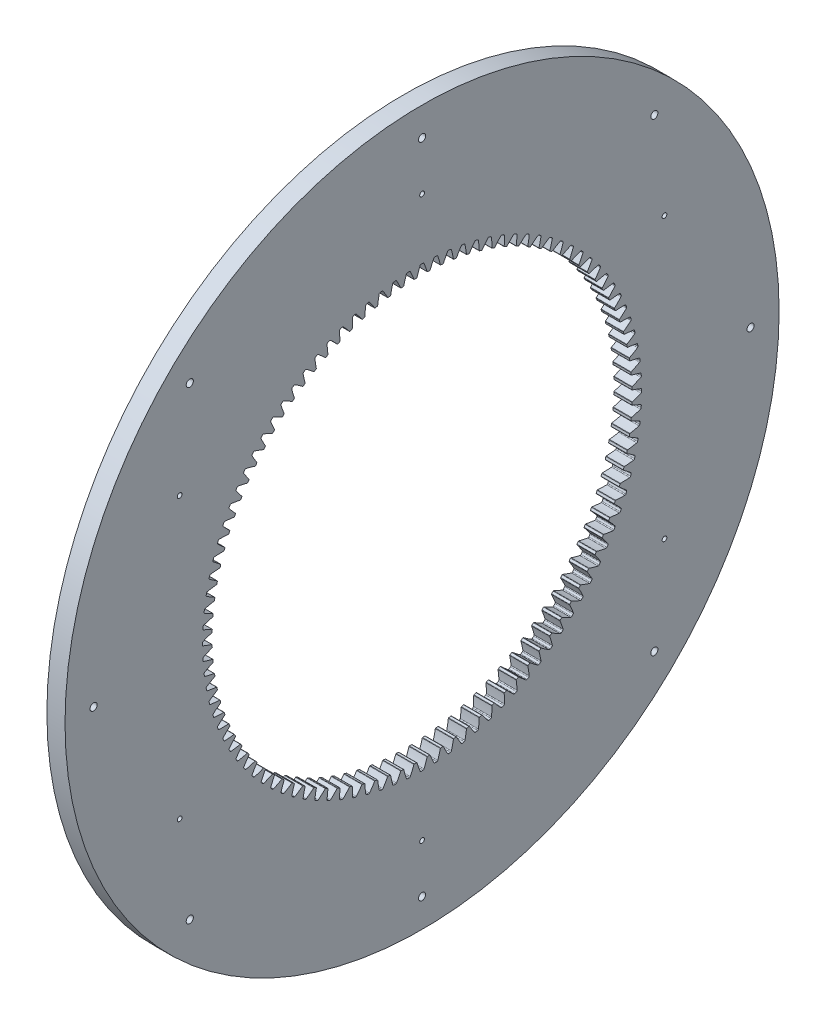
from build123d import *

# Parameters (mm, degrees)
BASPROSKE_W                 = 12.7
BASPROSKE_H                 = 103
TOOTHCUT_DEPTH              = 354.781415566
BREAKS_R                    = 0.3
ROOTFILLETS_R               = 0.751
TEETHCUTS_COUNT             = 100
TEETHCUTS_ANGLE             = 356.4
BREAKS_OF_TEETHCUTS_R       = 0.3
ROOTFILLETS_OF_TEETHCUTS_R  = 0.751
TAP_DRILL_FOR_M6X1_0_TAP1_D = 5
TAP_DRILL_FOR_M4X0_7_TAP1_D = 3.3


with BuildPart() as part:
    # BasProSke → Base-Revolve (revolve)
    with BuildSketch(Plane(origin=(0, 0, 0), x_dir=(1, 0, 0), z_dir=(0, 1, 0)), mode=Mode.PRIVATE) as base_revolve_sk:
        with Locations((6.35, 198.5)):
            Rectangle(BASPROSKE_W, BASPROSKE_H)
    revolve(base_revolve_sk.sketch.rotate(Axis((-10, 0, 0), (1, 0, 0)), 180), axis=Axis((-10, 0, 0), (1, 0, 0)))

    # TooCutSke → ToothCut (cut, through all)
    with BuildSketch(Plane(origin=(0, 0, 0), x_dir=(0, 0, -1), z_dir=(1, 0, 0))):
        with BuildLine():
            ThreePointArc((3.637427826, 146.929582331), (2.482947495, 150.368007742), (1.163580625, 153.746596974))
            ThreePointArc((1.163580625, 153.746596974), (0, 153.751), (-1.163580625, 153.746596974))
            ThreePointArc((-1.163580625, 153.746596974), (-2.482947495, 150.368007742), (-3.637427826, 146.929582331))
            ThreePointArc((-3.637427826, 146.929582331), (0, 146.9746), (3.637427826, 146.929582331))
        make_face()
    toothcut = extrude(amount=TOOTHCUT_DEPTH, mode=Mode.SUBTRACT)

    # Breaks
    breaks_edges = [part.edges().sort_by_distance(p)[0] for p in [
        (6.35, 146.955185887, 3.629509754),
        (6.35, 146.955185887, -3.629509754),
    ]]
    fillet(breaks_edges, radius=BREAKS_R)

    # RootFillets
    rootfillets_edges = [part.edges().sort_by_distance(p)[0] for p in [
        (6.35, 153.746596974, 1.163580625),
        (6.35, 153.746596974, -1.163580625),
    ]]
    fillet(rootfillets_edges, radius=ROOTFILLETS_R)

    # TeethCuts: ToothCut ×100 about axis
    teethcuts_axis = Axis((-10, 0, 0), (1, 0, 0))
    for i in range(1, TEETHCUTS_COUNT):
        add(toothcut.rotate(teethcuts_axis, i * TEETHCUTS_ANGLE / (TEETHCUTS_COUNT - 1)), mode=Mode.SUBTRACT)

    # Breaks of TeethCuts
    breaks_of_teethcuts_edges = [part.edges().sort_by_distance(p)[0] for p in [
        (6.35, 146.437304593, 12.849740215),
        (6.35, 146.893102199, 5.605044724),
        (6.35, 145.341502159, 22.019258622),
        (6.35, 146.251298546, 14.817478651),
        (6.35, 143.672103216, 31.101877075),
        (6.35, 145.032307834, 23.971434759),
        (6.35, 141.435696119, 40.061750627),
        (6.35, 143.240940861, 33.030786565),
        (6.35, 138.641106945, 48.863518753),
        (6.35, 140.884267336, 41.959780948),
        (6.35, 135.299364662, 57.472444894),
        (6.35, 137.971587971, 50.723179244),
        (6.35, 131.423657598, 65.854553551),
        (6.35, 134.514397782, 59.286396326),
        (6.35, 127.0292814, 73.976764372),
        (6.35, 130.526340719, 67.615637086),
        (6.35, 122.133578662, 81.8070227),
        (6.35, 126.02315582, 75.678029818),
        (6.35, 116.755870487, 89.314426084),
        (6.35, 121.0226151, 83.44175594),
        (6.35, 110.917380232, 96.469346232),
        (6.35, 115.544453408, 90.876175572),
        (6.35, 104.64114975, 103.243545944),
        (6.35, 109.610290546, 97.951948456),
        (6.35, 97.951948456, 109.610290546),
        (6.35, 103.243545944, 104.64114975),
        (6.35, 90.876175572, 115.544453408),
        (6.35, 96.469346232, 110.917380232),
        (6.35, 83.44175594, 121.0226151),
        (6.35, 89.314426084, 116.755870487),
        (6.35, 75.678029818, 126.02315582),
        (6.35, 81.8070227, 122.133578662),
        (6.35, 67.615637086, 130.526340719),
        (6.35, 73.976764372, 127.0292814),
        (6.35, 59.286396326, 134.514397782),
        (6.35, 65.854553551, 131.423657598),
        (6.35, 50.723179244, 137.971587971),
        (6.35, 57.472444894, 135.299364662),
        (6.35, 41.959780948, 140.884267336),
        (6.35, 48.863518753, 138.641106945),
        (6.35, 33.030786565, 143.240940861),
        (6.35, 40.061750627, 141.435696119),
        (6.35, 23.971434759, 145.032307834),
        (6.35, 31.101877074, 143.672103216),
        (6.35, 14.817478651, 146.251298546),
        (6.35, 22.019258622, 145.341502159),
        (6.35, 5.605044724, 146.893102199),
        (6.35, 12.849740215, 146.437304593),
        (6.35, -3.629509754, 146.955185887),
        (6.35, 3.629509754, 146.955185887),
        (6.35, -12.849740215, 146.437304593),
        (6.35, -5.605044724, 146.893102199),
        (6.35, -22.019258622, 145.341502159),
        (6.35, -14.817478651, 146.251298546),
        (6.35, -31.101877075, 143.672103216),
        (6.35, -23.971434759, 145.032307834),
        (6.35, -40.061750627, 141.435696119),
        (6.35, -33.030786565, 143.240940861),
        (6.35, -48.863518753, 138.641106945),
        (6.35, -41.959780948, 140.884267336),
        (6.35, -57.472444894, 135.299364662),
        (6.35, -50.723179244, 137.971587971),
        (6.35, -65.854553551, 131.423657598),
        (6.35, -59.286396326, 134.514397782),
        (6.35, -73.976764372, 127.0292814),
        (6.35, -67.615637086, 130.526340719),
        (6.35, -81.8070227, 122.133578662),
        (6.35, -75.678029818, 126.02315582),
        (6.35, -89.314426084, 116.755870487),
        (6.35, -83.44175594, 121.0226151),
        (6.35, -96.469346232, 110.917380232),
        (6.35, -90.876175572, 115.544453408),
        (6.35, -103.243545944, 104.64114975),
        (6.35, -97.951948456, 109.610290546),
        (6.35, -109.610290546, 97.951948456),
        (6.35, -104.64114975, 103.243545944),
        (6.35, -115.544453408, 90.876175572),
        (6.35, -110.917380232, 96.469346232),
        (6.35, -121.0226151, 83.44175594),
        (6.35, -116.755870487, 89.314426084),
        (6.35, -126.02315582, 75.678029818),
        (6.35, -122.133578662, 81.8070227),
        (6.35, -130.526340719, 67.615637086),
        (6.35, -127.0292814, 73.976764372),
        (6.35, -134.514397782, 59.286396326),
        (6.35, -131.423657598, 65.854553551),
        (6.35, -137.971587971, 50.723179244),
        (6.35, -135.299364662, 57.472444894),
        (6.35, -140.884267336, 41.959780948),
        (6.35, -138.641106945, 48.863518753),
        (6.35, -143.240940861, 33.030786565),
        (6.35, -141.435696119, 40.061750627),
        (6.35, -145.032307834, 23.971434759),
        (6.35, -143.672103216, 31.101877074),
        (6.35, -146.251298546, 14.817478651),
        (6.35, -145.341502159, 22.019258622),
        (6.35, -146.893102199, 5.605044724),
        (6.35, -146.437304593, 12.849740215),
        (6.35, -146.955185887, -3.629509754),
        (6.35, -146.955185887, 3.629509754),
        (6.35, -146.437304593, -12.849740215),
        (6.35, -146.893102199, -5.605044724),
        (6.35, -145.341502159, -22.019258622),
        (6.35, -146.251298546, -14.817478651),
        (6.35, -143.672103216, -31.101877075),
        (6.35, -145.032307834, -23.971434759),
        (6.35, -141.435696119, -40.061750627),
        (6.35, -143.240940861, -33.030786565),
        (6.35, -138.641106945, -48.863518753),
        (6.35, -140.884267336, -41.959780948),
        (6.35, -135.299364662, -57.472444894),
        (6.35, -137.971587971, -50.723179244),
        (6.35, -131.423657598, -65.854553551),
        (6.35, -134.514397782, -59.286396326),
        (6.35, -127.0292814, -73.976764372),
        (6.35, -130.526340719, -67.615637086),
        (6.35, -122.133578662, -81.8070227),
        (6.35, -126.02315582, -75.678029818),
        (6.35, -116.755870487, -89.314426084),
        (6.35, -121.0226151, -83.44175594),
        (6.35, -110.917380232, -96.469346232),
        (6.35, -115.544453408, -90.876175572),
        (6.35, -104.64114975, -103.243545944),
        (6.35, -109.610290546, -97.951948456),
        (6.35, -97.951948456, -109.610290546),
        (6.35, -103.243545944, -104.64114975),
        (6.35, -90.876175572, -115.544453408),
        (6.35, -96.469346232, -110.917380232),
        (6.35, -83.44175594, -121.0226151),
        (6.35, -89.314426084, -116.755870487),
        (6.35, -75.678029818, -126.02315582),
        (6.35, -81.8070227, -122.133578662),
        (6.35, -67.615637086, -130.526340719),
        (6.35, -73.976764372, -127.0292814),
        (6.35, -59.286396326, -134.514397782),
        (6.35, -65.854553551, -131.423657598),
        (6.35, -50.723179244, -137.971587971),
        (6.35, -57.472444894, -135.299364662),
        (6.35, -41.959780948, -140.884267336),
        (6.35, -48.863518753, -138.641106945),
        (6.35, -33.030786565, -143.240940861),
        (6.35, -40.061750627, -141.435696119),
        (6.35, -23.971434759, -145.032307834),
        (6.35, -31.101877074, -143.672103216),
        (6.35, -14.817478651, -146.251298546),
        (6.35, -22.019258622, -145.341502159),
        (6.35, -5.605044724, -146.893102199),
        (6.35, -12.849740215, -146.437304593),
        (6.35, 3.629509754, -146.955185887),
        (6.35, -3.629509754, -146.955185887),
        (6.35, 12.849740215, -146.437304593),
        (6.35, 5.605044724, -146.893102199),
        (6.35, 22.019258622, -145.341502159),
        (6.35, 14.817478651, -146.251298546),
        (6.35, 31.101877075, -143.672103216),
        (6.35, 23.971434759, -145.032307834),
        (6.35, 40.061750627, -141.435696119),
        (6.35, 33.030786565, -143.240940861),
        (6.35, 48.863518753, -138.641106945),
        (6.35, 41.959780948, -140.884267336),
        (6.35, 57.472444894, -135.299364662),
        (6.35, 50.723179244, -137.971587971),
        (6.35, 65.854553551, -131.423657598),
        (6.35, 59.286396326, -134.514397782),
        (6.35, 73.976764372, -127.0292814),
        (6.35, 67.615637086, -130.526340719),
        (6.35, 81.8070227, -122.133578662),
        (6.35, 75.678029818, -126.02315582),
        (6.35, 89.314426084, -116.755870487),
        (6.35, 83.44175594, -121.0226151),
        (6.35, 96.469346232, -110.917380232),
        (6.35, 90.876175572, -115.544453408),
        (6.35, 103.243545944, -104.64114975),
        (6.35, 97.951948456, -109.610290546),
        (6.35, 109.610290546, -97.951948456),
        (6.35, 104.64114975, -103.243545944),
        (6.35, 115.544453408, -90.876175572),
        (6.35, 110.917380232, -96.469346232),
        (6.35, 121.0226151, -83.44175594),
        (6.35, 116.755870487, -89.314426084),
        (6.35, 126.02315582, -75.678029818),
        (6.35, 122.133578662, -81.8070227),
        (6.35, 130.526340719, -67.615637086),
        (6.35, 127.0292814, -73.976764372),
        (6.35, 134.514397782, -59.286396326),
        (6.35, 131.423657598, -65.854553551),
        (6.35, 137.971587971, -50.723179244),
        (6.35, 135.299364662, -57.472444894),
        (6.35, 140.884267336, -41.959780948),
        (6.35, 138.641106945, -48.863518753),
        (6.35, 143.240940861, -33.030786565),
        (6.35, 141.435696119, -40.061750627),
        (6.35, 145.032307834, -23.971434759),
        (6.35, 143.672103216, -31.101877074),
        (6.35, 146.251298546, -14.817478651),
        (6.35, 145.341502159, -22.019258622),
        (6.35, 146.893102199, -5.605044724),
        (6.35, 146.437304593, -12.849740215),
    ]]
    fillet(breaks_of_teethcuts_edges, radius=BREAKS_OF_TEETHCUTS_R)

    # RootFillets of TeethCuts
    rootfillets_of_teethcuts_edges = [part.edges().sort_by_distance(p)[0] for p in [
        (6.35, 153.370151353, 10.815113264),
        (6.35, 153.516275017, 8.492544136),
        (6.35, 152.388423813, 20.423963592),
        (6.35, 152.680094457, 18.115152704),
        (6.35, 150.805288784, 29.952209867),
        (6.35, 151.241355318, 27.666269041),
        (6.35, 148.626994176, 39.362248453),
        (6.35, 149.205735644, 37.108199254),
        (6.35, 145.862136723, 48.616942228),
        (6.35, 146.581269098, 46.403680357),
        (6.35, 142.521628055, 57.679767142),
        (6.35, 143.378313249, 55.516027334),
        (6.35, 138.618651633, 66.514956367),
        (6.35, 139.609508701, 64.409277913),
        (6.35, 134.168610721, 75.087641447),
        (6.35, 135.289729204, 73.048334499),
        (6.35, 129.189067599, 83.363989911),
        (6.35, 130.436022953, 81.399102681),
        (6.35, 123.699674248, 91.311338791),
        (6.35, 125.06754531, 89.428625792),
        (6.35, 117.722094796, 98.898323534),
        (6.35, 119.205483204, 97.105214973),
        (6.35, 111.279920018, 106.095001776),
        (6.35, 112.872971516, 104.398574234),
        (6.35, 104.398574234, 112.872971516),
        (6.35, 106.095001776, 111.279920018),
        (6.35, 97.105214973, 119.205483204),
        (6.35, 98.898323534, 117.722094796),
        (6.35, 89.428625792, 125.06754531),
        (6.35, 91.311338791, 123.699674248),
        (6.35, 81.399102681, 130.436022953),
        (6.35, 83.363989911, 129.189067599),
        (6.35, 73.048334499, 135.289729204),
        (6.35, 75.087641447, 134.168610721),
        (6.35, 64.409277913, 139.609508701),
        (6.35, 66.514956367, 138.618651633),
        (6.35, 55.516027334, 143.378313249),
        (6.35, 57.679767142, 142.521628055),
        (6.35, 46.403680357, 146.581269098),
        (6.35, 48.616942228, 145.862136723),
        (6.35, 37.108199254, 149.205735644),
        (6.35, 39.362248453, 148.626994176),
        (6.35, 27.666269041, 151.241355318),
        (6.35, 29.952209867, 150.805288784),
        (6.35, 18.115152704, 152.680094457),
        (6.35, 20.423963592, 152.388423813),
        (6.35, 8.492544136, 153.516275017),
        (6.35, 10.815113264, 153.370151353),
        (6.35, -1.163580625, 153.746596974),
        (6.35, 1.163580625, 153.746596974),
        (6.35, -10.815113264, 153.370151353),
        (6.35, -8.492544136, 153.516275017),
        (6.35, -20.423963592, 152.388423813),
        (6.35, -18.115152704, 152.680094457),
        (6.35, -29.952209867, 150.805288784),
        (6.35, -27.666269041, 151.241355318),
        (6.35, -39.362248453, 148.626994176),
        (6.35, -37.108199254, 149.205735644),
        (6.35, -48.616942228, 145.862136723),
        (6.35, -46.403680357, 146.581269098),
        (6.35, -57.679767142, 142.521628055),
        (6.35, -55.516027334, 143.378313249),
        (6.35, -66.514956367, 138.618651633),
        (6.35, -64.409277913, 139.609508701),
        (6.35, -75.087641447, 134.168610721),
        (6.35, -73.048334499, 135.289729204),
        (6.35, -83.363989911, 129.189067599),
        (6.35, -81.399102681, 130.436022953),
        (6.35, -91.311338791, 123.699674248),
        (6.35, -89.428625792, 125.06754531),
        (6.35, -98.898323534, 117.722094796),
        (6.35, -97.105214973, 119.205483204),
        (6.35, -106.095001776, 111.279920018),
        (6.35, -104.398574234, 112.872971516),
        (6.35, -112.872971516, 104.398574234),
        (6.35, -111.279920018, 106.095001776),
        (6.35, -119.205483204, 97.105214973),
        (6.35, -117.722094796, 98.898323534),
        (6.35, -125.06754531, 89.428625792),
        (6.35, -123.699674248, 91.311338791),
        (6.35, -130.436022953, 81.399102681),
        (6.35, -129.189067599, 83.363989911),
        (6.35, -135.289729204, 73.048334499),
        (6.35, -134.168610721, 75.087641447),
        (6.35, -139.609508701, 64.409277913),
        (6.35, -138.618651633, 66.514956367),
        (6.35, -143.378313249, 55.516027334),
        (6.35, -142.521628055, 57.679767142),
        (6.35, -146.581269098, 46.403680357),
        (6.35, -145.862136723, 48.616942228),
        (6.35, -149.205735644, 37.108199254),
        (6.35, -148.626994176, 39.362248453),
        (6.35, -151.241355318, 27.666269041),
        (6.35, -150.805288784, 29.952209867),
        (6.35, -152.680094457, 18.115152704),
        (6.35, -152.388423813, 20.423963592),
        (6.35, -153.516275017, 8.492544136),
        (6.35, -153.370151353, 10.815113264),
        (6.35, -153.746596974, -1.163580625),
        (6.35, -153.746596974, 1.163580625),
        (6.35, -153.370151353, -10.815113264),
        (6.35, -153.516275017, -8.492544136),
        (6.35, -152.388423813, -20.423963592),
        (6.35, -152.680094457, -18.115152704),
        (6.35, -150.805288784, -29.952209867),
        (6.35, -151.241355318, -27.666269041),
        (6.35, -148.626994176, -39.362248453),
        (6.35, -149.205735644, -37.108199254),
        (6.35, -145.862136723, -48.616942228),
        (6.35, -146.581269098, -46.403680357),
        (6.35, -142.521628055, -57.679767142),
        (6.35, -143.378313249, -55.516027334),
        (6.35, -138.618651633, -66.514956367),
        (6.35, -139.609508701, -64.409277913),
        (6.35, -134.168610721, -75.087641447),
        (6.35, -135.289729204, -73.048334499),
        (6.35, -129.189067599, -83.363989911),
        (6.35, -130.436022953, -81.399102681),
        (6.35, -123.699674248, -91.311338791),
        (6.35, -125.06754531, -89.428625792),
        (6.35, -117.722094796, -98.898323534),
        (6.35, -119.205483204, -97.105214973),
        (6.35, -111.279920018, -106.095001776),
        (6.35, -112.872971516, -104.398574234),
        (6.35, -104.398574234, -112.872971516),
        (6.35, -106.095001776, -111.279920018),
        (6.35, -97.105214973, -119.205483204),
        (6.35, -98.898323534, -117.722094796),
        (6.35, -89.428625792, -125.06754531),
        (6.35, -91.311338791, -123.699674248),
        (6.35, -81.399102681, -130.436022953),
        (6.35, -83.363989911, -129.189067599),
        (6.35, -73.048334499, -135.289729204),
        (6.35, -75.087641447, -134.168610721),
        (6.35, -64.409277913, -139.609508701),
        (6.35, -66.514956367, -138.618651633),
        (6.35, -55.516027334, -143.378313249),
        (6.35, -57.679767142, -142.521628055),
        (6.35, -46.403680357, -146.581269098),
        (6.35, -48.616942228, -145.862136723),
        (6.35, -37.108199254, -149.205735644),
        (6.35, -39.362248453, -148.626994176),
        (6.35, -27.666269041, -151.241355318),
        (6.35, -29.952209867, -150.805288784),
        (6.35, -18.115152704, -152.680094457),
        (6.35, -20.423963592, -152.388423813),
        (6.35, -8.492544136, -153.516275017),
        (6.35, -10.815113264, -153.370151353),
        (6.35, 1.163580625, -153.746596974),
        (6.35, -1.163580625, -153.746596974),
        (6.35, 10.815113264, -153.370151353),
        (6.35, 8.492544136, -153.516275017),
        (6.35, 20.423963592, -152.388423813),
        (6.35, 18.115152704, -152.680094457),
        (6.35, 29.952209867, -150.805288784),
        (6.35, 27.666269041, -151.241355318),
        (6.35, 39.362248453, -148.626994176),
        (6.35, 37.108199254, -149.205735644),
        (6.35, 48.616942228, -145.862136723),
        (6.35, 46.403680357, -146.581269098),
        (6.35, 57.679767142, -142.521628055),
        (6.35, 55.516027334, -143.378313249),
        (6.35, 66.514956367, -138.618651633),
        (6.35, 64.409277913, -139.609508701),
        (6.35, 75.087641447, -134.168610721),
        (6.35, 73.048334499, -135.289729204),
        (6.35, 83.363989911, -129.189067599),
        (6.35, 81.399102681, -130.436022953),
        (6.35, 91.311338791, -123.699674248),
        (6.35, 89.428625792, -125.06754531),
        (6.35, 98.898323534, -117.722094796),
        (6.35, 97.105214973, -119.205483204),
        (6.35, 106.095001776, -111.279920018),
        (6.35, 104.398574234, -112.872971516),
        (6.35, 112.872971516, -104.398574234),
        (6.35, 111.279920018, -106.095001776),
        (6.35, 119.205483204, -97.105214973),
        (6.35, 117.722094796, -98.898323534),
        (6.35, 125.06754531, -89.428625792),
        (6.35, 123.699674248, -91.311338791),
        (6.35, 130.436022953, -81.399102681),
        (6.35, 129.189067599, -83.363989911),
        (6.35, 135.289729204, -73.048334499),
        (6.35, 134.168610721, -75.087641447),
        (6.35, 139.609508701, -64.409277913),
        (6.35, 138.618651633, -66.514956367),
        (6.35, 143.378313249, -55.516027334),
        (6.35, 142.521628055, -57.679767142),
        (6.35, 146.581269098, -46.403680357),
        (6.35, 145.862136723, -48.616942228),
        (6.35, 149.205735644, -37.108199254),
        (6.35, 148.626994176, -39.362248453),
        (6.35, 151.241355318, -27.666269041),
        (6.35, 150.805288784, -29.952209867),
        (6.35, 152.680094457, -18.115152704),
        (6.35, 152.388423813, -20.423963592),
        (6.35, 153.516275017, -8.492544136),
        (6.35, 153.370151353, -10.815113264),
    ]]
    fillet(rootfillets_of_teethcuts_edges, radius=ROOTFILLETS_OF_TEETHCUTS_R)

    # Tap Drill for M6x1.0 Tap1 (through all)
    with Locations(Plane(origin=(12.7, 230, 0), x_dir=(0, 0, 1), z_dir=(1, 0, 0))):
        with Locations((0, 0), (162.634559673, 67.365440327), (-162.634559673, 67.365440327), (230, 230), (-230, 230), (162.634559673, 392.634559673), (0, 460), (-162.634559673, 392.634559673)):
            Hole(TAP_DRILL_FOR_M6X1_0_TAP1_D / 2)

    # Tap Drill for M4x0.7 Tap1 (through all)
    with Locations(Plane(origin=(12.7, 196, 0), x_dir=(0, 0, 1), z_dir=(1, 0, 0))):
        with Locations((0, 0), (169.740979142, 98), (169.740979142, 294), (0, 392), (-169.740979142, 294), (-169.740979142, 98)):
            Hole(TAP_DRILL_FOR_M4X0_7_TAP1_D / 2)


solid = part.part
